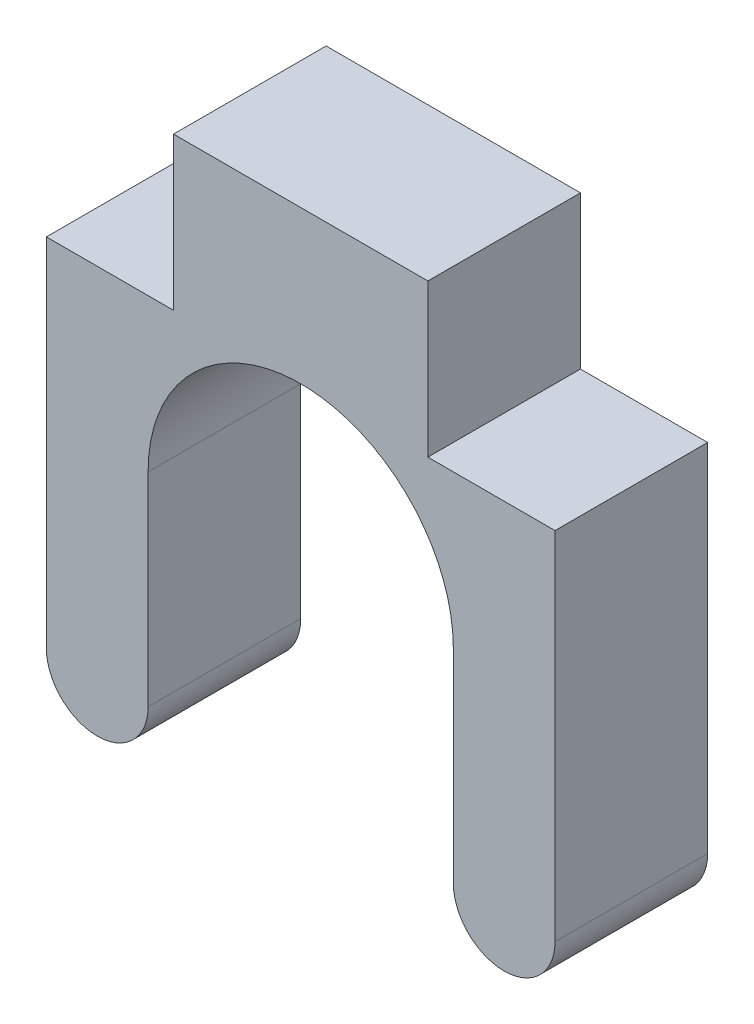
from build123d import *

# Parameters (mm, degrees)
BOSS_EXTRUDE1_DEPTH             = 15
BOSS_EXTRUDE2_REACH             = 1239.023
BOSS_EXTRUDE2_DIRECTION_2_REACH = 1239.023
CUT_EXTRUDE2_DEPTH              = 1238.578280352
CUT_EXTRUDE2_DEPTH_BACK         = 1238.578280352
SKETCH5_W                       = 40
SKETCH5_H                       = 40
CUT_EXTRUDE3_DEPTH              = 1238.578280352
BOSS_EXTRUDE4_DEPTH             = 75
CUT_EXTRUDE4_DEPTH              = 1241.107934819
CUT_EXTRUDE4_DEPTH_BACK         = 1241.107934819
SKETCH8_W                       = 15
SKETCH8_H                       = 73.7
FILLET1_R                       = 5
CUT_EXTRUDE5_DEPTH              = 1241.107934819
CUT_EXTRUDE5_DEPTH_BACK         = 1241.107934819
SKETCH10_W                      = 12.5
SKETCH10_H                      = 15
CUT_EXTRUDE6_DEPTH              = 453.023229492


with BuildPart() as part:
    # Sketch1 → Boss-Extrude1 (new body)
    with BuildSketch(Plane(origin=(0, 0, 0), x_dir=(1, 0, 0), z_dir=(0, 1, 0))):
        Polygon((-450, 300), (-400, 300), (-200, 250), (600, 40), (1200, 40), (1200, -40), (600, -40), (-200, -250), (-400, -300), (-450, -300), align=None)
    extrude(amount=BOSS_EXTRUDE1_DEPTH)

    # Boss-Extrude2: up to this face of the body (flat: up to its plane)
    boss_extrude2_end = Plane(part.part.faces().sort_by_distance((-425, 7.5, 300))[0])
    # Sketch2 → Boss-Extrude2 (add, up to the picked face)
    with BuildSketch(Plane.XY, mode=Mode.PRIVATE) as boss_extrude2_sk1:
        with BuildLine():
            Line((-425, 0), (-450, 0))
            Line((-450, 0), (-450, -40))
            Line((-450, -40), (-440, -40))
            Line((-440, -40), (-440, -15))
            ThreePointArc((-440, -15), (-435.606601718, -4.393398282), (-425, 0))
        make_face()
    boss_extrude2_tool1 = split(extrude(boss_extrude2_sk1.sketch, amount=BOSS_EXTRUDE2_REACH, mode=Mode.PRIVATE), bisect_by=boss_extrude2_end, keep=Keep.BOTH, mode=Mode.PRIVATE)
    # Sketch2 → Boss-Extrude2 (add, up to the picked face)
    with BuildSketch(Plane.XY, mode=Mode.PRIVATE) as boss_extrude2_sk2:
        with BuildLine():
            Line((-400, 0), (-425, 0))
            ThreePointArc((-425, 0), (-414.393398282, -4.393398282), (-410, -15))
            Line((-410, -15), (-410, -40))
            Line((-410, -40), (-400, -40))
            Line((-400, -40), (-400, 0))
        make_face()
    boss_extrude2_tool2 = split(extrude(boss_extrude2_sk2.sketch, amount=BOSS_EXTRUDE2_REACH, mode=Mode.PRIVATE), bisect_by=boss_extrude2_end, keep=Keep.BOTH, mode=Mode.PRIVATE)
    add(boss_extrude2_tool1.solids().sort_by(Axis((-444.100555, -18.206662, 0), (0, 0, 1)))[0])
    add(boss_extrude2_tool2.solids().sort_by(Axis((-405.899445, -18.206662, 0), (0, 0, 1)))[0])

    # Boss-Extrude2 direction 2: up to this face of the body (flat: up to its plane)
    boss_extrude2_direction_2_end = Plane(part.part.faces().sort_by_distance((-425, 7.5, -300))[0])
    # Sketch2 → Boss-Extrude2 direction 2 (add, up to the picked face)
    with BuildSketch(Plane.XY, mode=Mode.PRIVATE) as boss_extrude2_direction_2_sk1:
        with BuildLine():
            Line((-425, 0), (-450, 0))
            Line((-450, 0), (-450, -40))
            Line((-450, -40), (-440, -40))
            Line((-440, -40), (-440, -15))
            ThreePointArc((-440, -15), (-435.606601718, -4.393398282), (-425, 0))
        make_face()
    boss_extrude2_direction_2_tool1 = split(extrude(boss_extrude2_direction_2_sk1.sketch, amount=-BOSS_EXTRUDE2_DIRECTION_2_REACH, mode=Mode.PRIVATE), bisect_by=boss_extrude2_direction_2_end, keep=Keep.BOTH, mode=Mode.PRIVATE)
    # Sketch2 → Boss-Extrude2 direction 2 (add, up to the picked face)
    with BuildSketch(Plane.XY, mode=Mode.PRIVATE) as boss_extrude2_direction_2_sk2:
        with BuildLine():
            Line((-400, 0), (-425, 0))
            ThreePointArc((-425, 0), (-414.393398282, -4.393398282), (-410, -15))
            Line((-410, -15), (-410, -40))
            Line((-410, -40), (-400, -40))
            Line((-400, -40), (-400, 0))
        make_face()
    boss_extrude2_direction_2_tool2 = split(extrude(boss_extrude2_direction_2_sk2.sketch, amount=-BOSS_EXTRUDE2_DIRECTION_2_REACH, mode=Mode.PRIVATE), bisect_by=boss_extrude2_direction_2_end, keep=Keep.BOTH, mode=Mode.PRIVATE)
    add(boss_extrude2_direction_2_tool1.solids().sort_by(Axis((-444.100555, -18.206662, 0), (0, 0, -1)))[0])
    add(boss_extrude2_direction_2_tool2.solids().sort_by(Axis((-405.899445, -18.206662, 0), (0, 0, -1)))[0])

    # Sketch4 → Cut-Extrude2 (cut, two sides: drawn at the far end of the back side and taken through both)
    with BuildSketch(Plane(origin=(0, 0, 0), x_dir=(1, 0, 0), z_dir=(0, 1, 0)).offset(-CUT_EXTRUDE2_DEPTH_BACK)):
        Polygon((-450, 230), (-400, 230), (-150, 167.5), (-150, -167.5), (-400, -230), (-450, -230), align=None)
        Polygon((-100, 155), (-100, -155), (520, 0), align=None)
    extrude(amount=CUT_EXTRUDE2_DEPTH + CUT_EXTRUDE2_DEPTH_BACK, mode=Mode.SUBTRACT)

    # Sketch5 → Cut-Extrude3 (cut, through all)
    with BuildSketch(Plane(origin=(0, 0, 0), x_dir=(0, 0, -1), z_dir=(1, 0, 0))):
        with Locations((-265, -20)):
            Rectangle(SKETCH5_W, SKETCH5_H)
        with Locations((265, -20)):
            Rectangle(SKETCH5_W, SKETCH5_H)
    extrude(amount=-CUT_EXTRUDE3_DEPTH, mode=Mode.SUBTRACT)

    # Sketch7 → Boss-Extrude4 (add)
    with BuildSketch(Plane(origin=(1200, 0, 0), x_dir=(0, 0, -1), z_dir=(1, 0, 0))):
        with BuildLine():
            Line((-87.5, 50), (-40, 15))
            Line((-40, 15), (40, 15))
            Line((40, 15), (87.5, 50))
            Line((87.5, 50), (87.5, 88.7))
            Line((87.5, 88.7), (58.5, 88.7))
            Line((58.5, 88.7), (58.5, 63.2))
            Line((58.5, 63.2), (48.5, 63.2))
            Line((48.5, 63.2), (48.5, 88.7))
            Line((48.5, 88.7), (20, 88.7))
            Line((20, 88.7), (20, 50))
            ThreePointArc((20, 50), (0, 30), (-20, 50))
            Line((-20, 50), (-20, 88.7))
            Line((-20, 88.7), (-63, 88.7))
            Line((-63, 88.7), (-63, 63.2))
            Line((-63, 63.2), (-73, 63.2))
            Line((-73, 63.2), (-73, 88.7))
            Line((-73, 88.7), (-87.5, 88.7))
            Line((-87.5, 88.7), (-87.5, 50))
        make_face()
    extrude(amount=-BOSS_EXTRUDE4_DEPTH)

    # Sketch8 → Cut-Extrude4 (cut, two sides: drawn at the far end of the back side and taken through both)
    with BuildSketch(Plane.XY.offset(-CUT_EXTRUDE4_DEPTH_BACK)):
        with Locations((1147.5, 51.85)):
            Rectangle(SKETCH8_W, SKETCH8_H)
        with Locations((1177.5, 51.85)):
            Rectangle(SKETCH8_W, SKETCH8_H)
    extrude(amount=CUT_EXTRUDE4_DEPTH + CUT_EXTRUDE4_DEPTH_BACK, mode=Mode.SUBTRACT)

    # Fillet1
    # the kernel refuses this fillet: 5 mm, written as the material it adds along each edge
    with BuildSketch(Plane(origin=(600, 0, -40), x_dir=(1, 0, 0), z_dir=(0, 1, 0)), Plane(origin=(600, 0, 40), x_dir=(-0.9672309653794254, 0, 0.25389812841213444), z_dir=(0, 1, 0))) as fillet1_piece_1:
        with BuildLine():
            CenterArc((FILLET1_R * 0.12906371081, FILLET1_R), FILLET1_R, 255.2916961, 14.7083039)
            Line((-FILLET1_R * 0.124834417602, FILLET1_R * 0.0327690346206), (0, 0))
            Line((0, 0), (FILLET1_R * 0.12906371081, 0))
        make_face()
    extrude(amount=15)
    with BuildSketch(Plane(origin=(-150, 15, -167.5), x_dir=(-0.9701425001453314, 0, -0.2425356250363347), z_dir=(0, -1, 0)), Plane(origin=(-150, 15, 167.5), x_dir=(0, 0, -1), z_dir=(0, -1, 0))) as fillet1_piece_2:
        with BuildLine():
            CenterArc((FILLET1_R * 0.780776406404, -FILLET1_R), FILLET1_R, 90, 75.963756532)
            Line((-FILLET1_R * 0.189366093741, -FILLET1_R * 0.757464374964), (0, 0))
            Line((0, 0), (FILLET1_R * 0.780776406404, 0))
        make_face()
    extrude(amount=15)
    with BuildSketch(Plane(origin=(-100, 15, -155), x_dir=(0.9701425001453314, 0, 0.24253562503633508), z_dir=(0, -1, 0)), Plane(origin=(-100, 0, 155), x_dir=(0.9701425001453319, 0, -0.24253562503633352), z_dir=(0, 1, 0))) as fillet1_piece_3:
        with BuildLine():
            CenterArc((FILLET1_R * 1.2807764064, FILLET1_R), FILLET1_R, 165.963756532, 104.036243468)
            Line((FILLET1_R * 0.310633906259, FILLET1_R * 1.24253562504), (0, 0))
            Line((0, 0), (FILLET1_R * 1.2807764064, 0))
        make_face()
    extrude(amount=15)
    with BuildSketch(Plane(origin=(520, 15, 0), x_dir=(-0.9701425001453318, 0, -0.24253562503633325), z_dir=(0, -1, 0))) as fillet1_piece_4:
        with BuildLine():
            CenterArc((FILLET1_R * 4, -FILLET1_R), FILLET1_R, 90, 151.927513064)
            Line((FILLET1_R * 3.52941176471, -FILLET1_R * 1.88235294118), (0, 0))
            Line((0, 0), (FILLET1_R * 4, 0))
        make_face()
    extrude(amount=15)
    # the kernel refuses this fillet: 5 mm, written as the material it takes off along each edge
    with BuildSketch(Plane(origin=(-440, -40, 217.5), x_dir=(0, 1, 0), z_dir=(0, 0, 1)), Plane(origin=(-400, -40, 217.5), x_dir=(0, 1, 0), z_dir=(0, 0, 1)), Plane(origin=(-440, -40, -312.5), x_dir=(0, 1, 0), z_dir=(0, 0, 1)), Plane(origin=(-450, -40, -312.5), x_dir=(1, 0, 0), z_dir=(0, 0, 1)), Plane(origin=(-400, -40, -312.5), x_dir=(0, 1, 0), z_dir=(0, 0, 1)), Plane(origin=(1152.5, 88.7, -20), x_dir=(0, 0, -1), z_dir=(-1, 0, 0)), Plane(origin=(1152.5, 88.7, -48.5), x_dir=(0, -1, 0), z_dir=(-1, 0, 0)), Plane(origin=(1152.5, 88.7, -58.5), x_dir=(0, 0, -1), z_dir=(-1, 0, 0)), Plane(origin=(1152.5, 88.7, -87.5), x_dir=(0, -1, 0), z_dir=(-1, 0, 0)), Plane(origin=(1152.5, 88.7, 87.5), x_dir=(0, 0, -1), z_dir=(-1, 0, 0)), Plane(origin=(1152.5, 88.7, 73), x_dir=(0, -1, 0), z_dir=(-1, 0, 0)), Plane(origin=(1152.5, 88.7, 63), x_dir=(0, 0, -1), z_dir=(-1, 0, 0)), Plane(origin=(1152.5, 88.7, 20), x_dir=(0, -1, 0), z_dir=(-1, 0, 0)), Plane(origin=(1182.5, 88.7, 20), x_dir=(0, -1, 0), z_dir=(-1, 0, 0)), Plane(origin=(1212.5, 88.7, 20), x_dir=(0, -1, 0), z_dir=(-1, 0, 0)), Plane(origin=(1182.5, 88.7, 63), x_dir=(0, 0, -1), z_dir=(-1, 0, 0)), Plane(origin=(1212.5, 88.7, 63), x_dir=(0, 0, -1), z_dir=(-1, 0, 0)), Plane(origin=(1182.5, 88.7, 73), x_dir=(0, -1, 0), z_dir=(-1, 0, 0)), Plane(origin=(1212.5, 88.7, 73), x_dir=(0, -1, 0), z_dir=(-1, 0, 0)), Plane(origin=(1182.5, 88.7, -87.5), x_dir=(0, -1, 0), z_dir=(-1, 0, 0)), Plane(origin=(1212.5, 88.7, -87.5), x_dir=(0, -1, 0), z_dir=(-1, 0, 0)), Plane(origin=(1182.5, 88.7, -58.5), x_dir=(0, 0, -1), z_dir=(-1, 0, 0)), Plane(origin=(1212.5, 88.7, -58.5), x_dir=(0, 0, -1), z_dir=(-1, 0, 0)), Plane(origin=(1182.5, 88.7, -48.5), x_dir=(0, -1, 0), z_dir=(-1, 0, 0)), Plane(origin=(1212.5, 88.7, -48.5), x_dir=(0, -1, 0), z_dir=(-1, 0, 0)), Plane(origin=(1182.5, 88.7, -20), x_dir=(0, 0, -1), z_dir=(-1, 0, 0)), Plane(origin=(1212.5, 88.7, -20), x_dir=(0, 0, -1), z_dir=(-1, 0, 0)), Plane(origin=(-410, -40, 312.5), x_dir=(0, 1, 0), z_dir=(0, 0, -1)), Plane(origin=(-410, -40, -217.5), x_dir=(0, 1, 0), z_dir=(0, 0, -1))) as fillet1_2_piece_1:
        with BuildLine():
            CenterArc((FILLET1_R, FILLET1_R), FILLET1_R, 180, 90)
            Line((0, FILLET1_R), (0, 0))
            Line((0, 0), (FILLET1_R, 0))
        make_face()
    extrude(amount=40, mode=Mode.SUBTRACT)
    with BuildSketch(Plane(origin=(-450, -40, 217.5), x_dir=(0, 1, 0), z_dir=(0, 0, 1)), Plane(origin=(-410, -40, 257.5), x_dir=(1, 0, 0), z_dir=(0, 0, -1)), Plane(origin=(-410, -40, -272.5), x_dir=(1, 0, 0), z_dir=(0, 0, -1)), Plane(origin=(1182.5, 88.7, 87.5), x_dir=(0, -1, 0), z_dir=(-1, 0, 0)), Plane(origin=(1212.5, 88.7, 87.5), x_dir=(0, -1, 0), z_dir=(-1, 0, 0)), Plane(origin=(-400, -40, 272.5), x_dir=(-1, 0, 0), z_dir=(0, 0, 1)), Plane(origin=(-450, -40, 272.5), x_dir=(0, 1, 0), z_dir=(0, 0, 1)), Plane(origin=(-440, -40, 272.5), x_dir=(-1, 0, 0), z_dir=(0, 0, 1)), Plane(origin=(-440, -40, -257.5), x_dir=(-1, 0, 0), z_dir=(0, 0, 1)), Plane(origin=(-450, -40, -257.5), x_dir=(0, 1, 0), z_dir=(0, 0, 1)), Plane(origin=(-400, -40, -257.5), x_dir=(-1, 0, 0), z_dir=(0, 0, 1))) as fillet1_2_piece_2:
        with BuildLine():
            CenterArc((FILLET1_R, -FILLET1_R), FILLET1_R, 90, 90)
            Line((0, -FILLET1_R), (0, 0))
            Line((0, 0), (FILLET1_R, 0))
        make_face()
    extrude(amount=40, mode=Mode.SUBTRACT)
    with BuildSketch(Plane(origin=(1146.316347002, 50, -87.5), x_dir=(0, -0.5931990380498489, 0.8050558373533688), z_dir=(-1, 0, 0)), Plane(origin=(1176.316347002, 50, -87.5), x_dir=(0, -0.5931990380498489, 0.8050558373533688), z_dir=(-1, 0, 0)), Plane(origin=(1206.316347002, 50, -87.5), x_dir=(0, -0.5931990380498489, 0.8050558373533688), z_dir=(-1, 0, 0))) as fillet1_2_piece_3:
        with BuildLine():
            CenterArc((FILLET1_R * 0.505307760127, FILLET1_R), FILLET1_R, 216.384351816, 53.615648184)
            Line((-FILLET1_R * 0.299748077226, FILLET1_R * 0.40680096195), (0, 0))
            Line((0, 0), (FILLET1_R * 0.505307760127, 0))
        make_face()
    extrude(amount=27.632694003, mode=Mode.SUBTRACT)
    with BuildSketch(Plane(origin=(1146.316347002, 50, 87.5), x_dir=(0, -0.5931990380498499, -0.8050558373533683), z_dir=(-1, 0, 0)), Plane(origin=(1176.316347002, 50, 87.5), x_dir=(0, -0.5931990380498499, -0.8050558373533683), z_dir=(-1, 0, 0)), Plane(origin=(1206.316347002, 50, 87.5), x_dir=(0, -0.5931990380498499, -0.8050558373533683), z_dir=(-1, 0, 0))) as fillet1_2_piece_4:
        with BuildLine():
            CenterArc((FILLET1_R * 0.505307760127, -FILLET1_R), FILLET1_R, 90, 53.615648184)
            Line((-FILLET1_R * 0.299748077226, -FILLET1_R * 0.40680096195), (0, 0))
            Line((0, 0), (FILLET1_R * 0.505307760127, 0))
        make_face()
    extrude(amount=27.632694003, mode=Mode.SUBTRACT)

    # Sketch9 → Cut-Extrude5 (cut, two sides: drawn at the far end of the back side and taken through both)
    with BuildSketch(Plane(origin=(0, 0, 0), x_dir=(1, 0, 0), z_dir=(0, 1, 0)).offset(-CUT_EXTRUDE5_DEPTH_BACK)):
        Polygon((-450, 285), (-450, -300), (1200, -300), (1200, 300), (-400, 300), (-400, 285), align=None)
    extrude(amount=CUT_EXTRUDE5_DEPTH + CUT_EXTRUDE5_DEPTH_BACK, mode=Mode.SUBTRACT)

    # Sketch10 → Cut-Extrude6 (cut, through all)
    with BuildSketch(Plane.XY.offset(-285)):
        with Locations((-443.75, 7.5)):
            Rectangle(SKETCH10_W, SKETCH10_H)
        with Locations((-406.25, 7.5)):
            Rectangle(SKETCH10_W, SKETCH10_H)
    extrude(amount=-CUT_EXTRUDE6_DEPTH, mode=Mode.SUBTRACT)


solid = part.part
